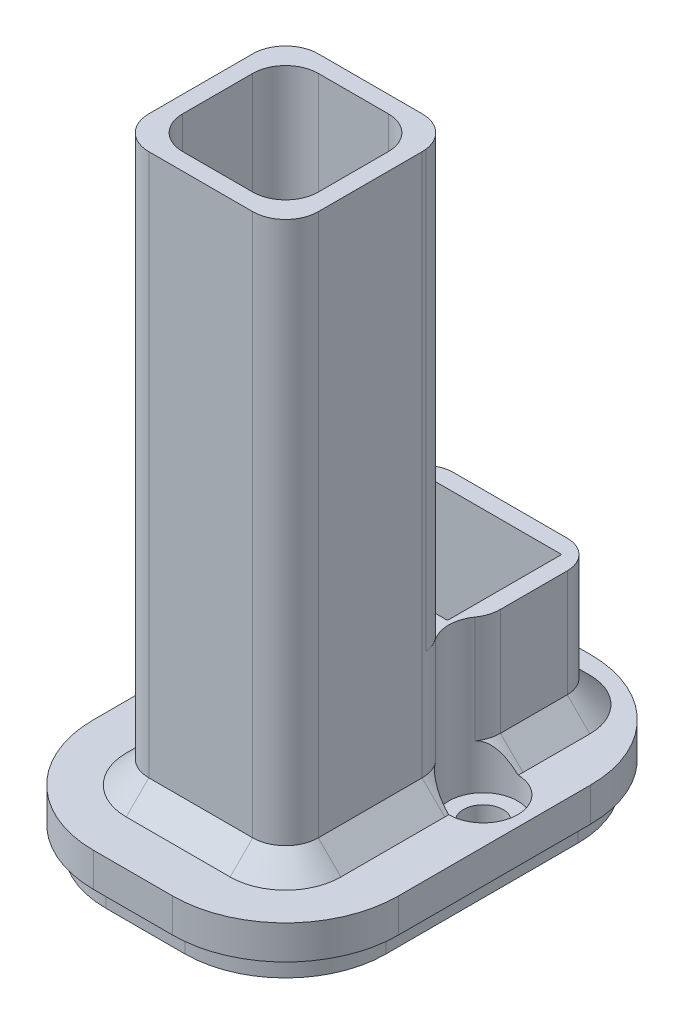
from build123d import *

# Parameters (mm, degrees)
SKETCH2_W               = 27
SKETCH2_H               = 37
SKETCH2_R               = 3
SKETCH2_W_2             = 15.1
SKETCH2_H_2             = 13.1
BOSS_EXTRUDE1_DEPTH     = 5
SKETCH2_7_W             = 15.1
SKETCH2_7_H             = 13.1
SKETCH2_7_W_2           = 12.1
SKETCH2_7_H_2           = 10.1
BOSS_EXTRUDE2_DEPTH     = 16.5
SKETCH2_8_W             = 12.1
SKETCH2_8_H             = 10.1
SKETCH2_8_R             = 4.25
BOSS_EXTRUDE3_DEPTH     = 1
SKETCH2_12_R            = 8.05
CUT_EXTRUDE3_DEPTH      = 4
SKETCH2_11_R            = 1.75
CUT_EXTRUDE2_DEPTH      = 32.729323976
FILLET1_R               = 10
CUT_EXTRUDE1_START      = -2
CUT_EXTRUDE1_DEPTH      = 2
SKETCH4_W               = 15
SKETCH4_H               = 15
SKETCH4_W_2             = 12
SKETCH4_H_2             = 12
BOSS_EXTRUDE8_DEPTH     = 50
FILLET4_R               = 2.5
CUT_EXTRUDE4_DEPTH      = 22
CUT_EXTRUDE4_DEPTH_BACK = 2
SKETCH4_3_R             = 1.75
FILLET3_START           = 16.5
FILLET3_DEPTH           = 38.5
FILLET3_START_2         = 5
FILLET3_2_DEPTH         = 11.898030769
FILLET5_R               = 3
CHAMFER1_SIZE           = 2
FILLET6_R               = 2.9


with BuildPart() as part:
    # Sketch2 → Boss-Extrude1 (new body)
    with BuildSketch(Plane(origin=(0, 0, 0), x_dir=(1, 0, 0), z_dir=(0, 1, 0))):
        with Locations((0, 5)):
            Rectangle(SKETCH2_W, SKETCH2_H)
        with Locations(Location((0, 0, 0), (0, 0, 270))):
            Circle(SKETCH2_R, mode=Mode.SUBTRACT)
        with Locations((0, 13.34)):
            Rectangle(SKETCH2_W_2, SKETCH2_H_2, mode=Mode.SUBTRACT)
    extrude(amount=BOSS_EXTRUDE1_DEPTH)

    # Sketch2<7> → Boss-Extrude2 (add)
    with BuildSketch(Plane(origin=(0, 0, 0), x_dir=(1, 0, 0), z_dir=(0, 1, 0))):
        with Locations((0, 13.34)):
            Rectangle(SKETCH2_7_W, SKETCH2_7_H)
        with Locations((0, 13.34)):
            Rectangle(SKETCH2_7_W_2, SKETCH2_7_H_2, mode=Mode.SUBTRACT)
    extrude(amount=BOSS_EXTRUDE2_DEPTH)

    # Sketch2<8> → Boss-Extrude3 (add)
    with BuildSketch(Plane(origin=(0, 0, 0), x_dir=(1, 0, 0), z_dir=(0, 1, 0))):
        with Locations((0, 13.34)):
            Rectangle(SKETCH2_8_W, SKETCH2_8_H)
        with Locations(Location((0, 13.34, 0), (0, 0, 270))):
            Circle(SKETCH2_8_R, mode=Mode.SUBTRACT)
    extrude(amount=BOSS_EXTRUDE3_DEPTH)

    # Sketch2<12> → Cut-Extrude3 (cut)
    with BuildSketch(Plane(origin=(0, 0, 0), x_dir=(1, 0, 0), z_dir=(0, 1, 0))):
        with Locations(Location((0, 0, 0), (0, 0, 270))):
            Circle(SKETCH2_12_R)
    extrude(amount=CUT_EXTRUDE3_DEPTH, mode=Mode.SUBTRACT)

    # Sketch2<11> → Cut-Extrude2 (cut, through all)
    with BuildSketch(Plane(origin=(0, 0, 0), x_dir=(1, 0, 0), z_dir=(0, 1, 0))):
        with Locations(Location((-9.5, 8, 0), (0, 0, 270))):
            Circle(SKETCH2_11_R)
        with Locations(Location((9.5, 8, 0), (0, 0, 270))):
            Circle(SKETCH2_11_R)
    extrude(amount=CUT_EXTRUDE2_DEPTH, mode=Mode.SUBTRACT)

    # Fillet1
    fillet1_edges = [part.edges().sort_by_distance(p)[0] for p in [
        (-13.5, 2.5, -23.5),
        (13.5, 2.5, -23.5),
        (13.5, 2.5, 13.5),
        (-13.5, 2.5, 13.5),
    ]]
    fillet(fillet1_edges, radius=FILLET1_R)

    # Sketch3 → Cut-Extrude1 (cut)
    with BuildSketch(Plane.XZ.offset(CUT_EXTRUDE1_START)):
        with BuildLine():
            Line((-13.5, 3.5), (-13.5, -13.5))
            ThreePointArc((-13.5, -13.5), (-10.571067812, -20.571067812), (-3.5, -23.5))
            Line((-3.5, -23.5), (3.5, -23.5))
            ThreePointArc((3.5, -23.5), (10.571067812, -20.571067812), (13.5, -13.5))
            Line((13.5, -13.5), (13.5, 3.5))
            ThreePointArc((13.5, 3.5), (10.571067812, 10.571067812), (3.5, 13.5))
            Line((3.5, 13.5), (-3.5, 13.5))
            ThreePointArc((-3.5, 13.5), (-10.571067812, 10.571067812), (-13.5, 3.5))
        make_face()
        with BuildLine():
            Line((-12.4, 3.5), (-12.4, -13.5))
            ThreePointArc((-12.4, -13.5), (-9.793250353, -19.793250353), (-3.5, -22.4))
            Line((-3.5, -22.4), (3.5, -22.4))
            ThreePointArc((3.5, -22.4), (9.793250353, -19.793250353), (12.4, -13.5))
            Line((12.4, -13.5), (12.4, 3.5))
            ThreePointArc((12.4, 3.5), (9.793250353, 9.793250353), (3.5, 12.4))
            Line((3.5, 12.4), (-3.5, 12.4))
            ThreePointArc((-3.5, 12.4), (-9.793250353, 9.793250353), (-12.4, 3.5))
        make_face(mode=Mode.SUBTRACT)
    extrude(amount=CUT_EXTRUDE1_DEPTH, mode=Mode.SUBTRACT)

    # Sketch4 → Boss-Extrude8 (add)
    with BuildSketch(Plane(origin=(0, 5, 0), x_dir=(1, 0, 0), z_dir=(0, 1, 0))):
        Rectangle(SKETCH4_W, SKETCH4_H)
        Rectangle(SKETCH4_W_2, SKETCH4_H_2, mode=Mode.SUBTRACT)
    extrude(amount=BOSS_EXTRUDE8_DEPTH)

    # Fillet4
    # the kernel refuses this fillet: 2.5 mm, written as the material it takes off along each edge
    with BuildSketch(Plane(origin=(-7.55, 5, -19.89), x_dir=(0, 0, 1), z_dir=(0, 1, 0))) as fillet4_piece_1:
        with BuildLine():
            CenterArc((FILLET4_R, FILLET4_R), FILLET4_R, 180, 90)
            Line((0, FILLET4_R), (0, 0))
            Line((0, 0), (FILLET4_R, 0))
        make_face()
    extrude(amount=17.75, mode=Mode.SUBTRACT)
    with BuildSketch(Plane(origin=(7.55, 5, -19.89), x_dir=(0, 0, 1), z_dir=(0, 1, 0))) as fillet4_piece_2:
        with BuildLine():
            CenterArc((FILLET4_R, -FILLET4_R), FILLET4_R, 90, 90)
            Line((0, -FILLET4_R), (0, 0))
            Line((0, 0), (FILLET4_R, 0))
        make_face()
    extrude(amount=17.75, mode=Mode.SUBTRACT)
    with BuildSketch(Plane(origin=(7.55, 5, -6.79), x_dir=(-1, 0, 0), z_dir=(0, 1, 0))) as fillet4_piece_3:
        with BuildLine():
            CenterArc((2.5, -0.497493719), FILLET4_R, 168.521659045, 11.478340955)
            Line((0, -0.497493719), (0, 0))
            Line((0, 0), (0.05, 0))
        make_face()
    extrude(amount=12.743734296, mode=Mode.SUBTRACT)
    with BuildSketch(Plane(origin=(-7.55, 5, -6.79), x_dir=(0, 0, -1), z_dir=(0, 1, 0))) as fillet4_piece_4:
        with BuildLine():
            CenterArc((0.497493719, -2.5), FILLET4_R, 90, 11.478340955)
            Line((0, -0.05), (0, 0))
            Line((0, 0), (0.497493719, 0))
        make_face()
    extrude(amount=12.743734296, mode=Mode.SUBTRACT)

    # Sketch4<3> → Cut-Extrude4 (cut, two sides: drawn at the far end of the back side and taken through both)
    # profile 1 of 8: a face of its own
    with BuildSketch(Plane(origin=(0, 5, 0), x_dir=(1, 0, 0), z_dir=(0, 1, 0)).offset(-CUT_EXTRUDE4_DEPTH_BACK)):
        with BuildLine():
            Line((7.5, 6.79), (7.5, 5.697284212))
            ThreePointArc((7.5, 5.697284212), (10.765405073, 5.22488739), (12.55, 8))
            ThreePointArc((12.55, 8), (10.795183385, 10.761340254), (7.55, 10.34520788))
            Line((7.55, 10.34520788), (7.55, 6.79))
            Line((7.55, 6.79), (7.5, 6.79))
        make_face()
        with Locations(Location((9.5, 8, 0), (0, 0, 270))):
            Circle(SKETCH4_3_R, mode=Mode.SUBTRACT)
    # profile 2 of 8: a face of its own
    with BuildSketch(Plane(origin=(0, 5, 0), x_dir=(1, 0, 0), z_dir=(0, 1, 0)).offset(-CUT_EXTRUDE4_DEPTH_BACK)):
        with BuildLine():
            Line((7.5, 7.5), (7.5, 6.79))
            Line((7.5, 6.79), (7.55, 6.79))
            Line((7.55, 6.79), (7.55, 10.34520788))
            ThreePointArc((7.55, 10.34520788), (6.641491505, 9.063686601), (6.491262723, 7.5))
            Line((6.491262723, 7.5), (7.5, 7.5))
        make_face()
    # profile 3 of 8: a face of its own
    with BuildSketch(Plane(origin=(0, 5, 0), x_dir=(1, 0, 0), z_dir=(0, 1, 0)).offset(-CUT_EXTRUDE4_DEPTH_BACK)):
        with BuildLine():
            Line((6.700285729, 6.79), (7.5, 6.79))
            Line((7.5, 6.79), (7.5, 7.5))
            Line((7.5, 7.5), (6.491262723, 7.5))
            ThreePointArc((6.491262723, 7.5), (6.57415784, 7.138636166), (6.700285729, 6.79))
        make_face()
    # profile 4 of 8: a face of its own
    with BuildSketch(Plane(origin=(0, 5, 0), x_dir=(1, 0, 0), z_dir=(0, 1, 0)).offset(-CUT_EXTRUDE4_DEPTH_BACK)):
        with BuildLine():
            ThreePointArc((6.700285729, 6.79), (7.038735849, 6.198700808), (7.5, 5.697284212))
            Line((7.5, 5.697284212), (7.5, 6.79))
            Line((7.5, 6.79), (6.700285729, 6.79))
        make_face()
    # profile 5 of 8: a face of its own
    with BuildSketch(Plane(origin=(0, 5, 0), x_dir=(1, 0, 0), z_dir=(0, 1, 0)).offset(-CUT_EXTRUDE4_DEPTH_BACK)):
        with BuildLine():
            Line((-7.55, 6.79), (-7.5, 6.79))
            Line((-7.5, 6.79), (-7.5, 7.5))
            Line((-7.5, 7.5), (-6.491262723, 7.5))
            ThreePointArc((-6.491262723, 7.5), (-6.460333185, 7.749150138), (-6.45, 8))
            ThreePointArc((-6.45, 8), (-6.738659746, 9.295183385), (-7.55, 10.34520788))
            Line((-7.55, 10.34520788), (-7.55, 6.79))
        make_face()
    # profile 6 of 8: a face of its own
    with BuildSketch(Plane(origin=(0, 5, 0), x_dir=(1, 0, 0), z_dir=(0, 1, 0)).offset(-CUT_EXTRUDE4_DEPTH_BACK)):
        with BuildLine():
            Line((-7.5, 6.79), (-6.700285729, 6.79))
            ThreePointArc((-6.700285729, 6.79), (-6.57415784, 7.138636166), (-6.491262723, 7.5))
            Line((-6.491262723, 7.5), (-7.5, 7.5))
            Line((-7.5, 7.5), (-7.5, 6.79))
        make_face()
    # profile 7 of 8: a face of its own
    with BuildSketch(Plane(origin=(0, 5, 0), x_dir=(1, 0, 0), z_dir=(0, 1, 0)).offset(-CUT_EXTRUDE4_DEPTH_BACK)):
        with BuildLine():
            ThreePointArc((-7.55, 10.34520788), (-12.549823537, 7.967191549), (-7.5, 5.697284212))
            Line((-7.5, 5.697284212), (-7.5, 6.79))
            Line((-7.5, 6.79), (-7.55, 6.79))
            Line((-7.55, 6.79), (-7.55, 10.34520788))
        make_face()
        with Locations(Location((-9.5, 8, 0), (0, 0, 270))):
            Circle(SKETCH4_3_R, mode=Mode.SUBTRACT)
    # profile 8 of 8: a face of its own
    with BuildSketch(Plane(origin=(0, 5, 0), x_dir=(1, 0, 0), z_dir=(0, 1, 0)).offset(-CUT_EXTRUDE4_DEPTH_BACK)):
        with BuildLine():
            Line((-7.5, 6.79), (-7.5, 5.697284212))
            ThreePointArc((-7.5, 5.697284212), (-7.038735849, 6.198700808), (-6.700285729, 6.79))
            Line((-6.700285729, 6.79), (-7.5, 6.79))
        make_face()
    extrude(amount=CUT_EXTRUDE4_DEPTH + CUT_EXTRUDE4_DEPTH_BACK, mode=Mode.SUBTRACT)

    # Fillet3: read off the stored shape, not the designer's step
    # Fillet3 outline → Fillet3 (cut)
    with BuildSketch(Plane(origin=(0, 0, 0), x_dir=(1, 0, 0), z_dir=(0, 1, 0)).offset(FILLET3_START)):
        with BuildLine():
            Line((7.5, -7.5), (7.5, -4.6))
            ThreePointArc((7.5, -4.6), (6.650609665, -6.650609665), (4.6, -7.5))
            Line((4.6, -7.5), (7.5, -7.5))
        make_face()
        with BuildLine():
            ThreePointArc((4.6, 7.5), (6.650609665, 6.650609665), (7.5, 4.6))
            Line((7.5, 4.6), (7.5, 7.5))
            Line((7.5, 7.5), (4.6, 7.5))
        make_face()
        with BuildLine():
            Line((-7.5, -7.5), (-4.6, -7.5))
            ThreePointArc((-4.6, -7.5), (-6.650609665, -6.650609665), (-7.5, -4.6))
            Line((-7.5, -4.6), (-7.5, -7.5))
        make_face()
        with BuildLine():
            ThreePointArc((-7.5, 4.6), (-6.650609665, 6.650609665), (-4.6, 7.5))
            Line((-4.6, 7.5), (-7.5, 7.5))
            Line((-7.5, 7.5), (-7.5, 4.6))
        make_face()
    extrude(amount=FILLET3_DEPTH, mode=Mode.SUBTRACT)

    # Fillet3 2 outline → Fillet3 2 (cut)
    with BuildSketch(Plane(origin=(0, 0, 0), x_dir=(1, 0, 0), z_dir=(0, 1, 0)).offset(FILLET3_START_2)):
        with BuildLine():
            Line((7.5, -7.5), (7.5, -4.6))
            ThreePointArc((7.5, -4.6), (6.650609665, -6.650609665), (4.6, -7.5))
            Line((4.6, -7.5), (7.5, -7.5))
        make_face()
        with BuildLine():
            Line((-7.5, -7.5), (-4.6, -7.5))
            ThreePointArc((-4.6, -7.5), (-6.650609665, -6.650609665), (-7.5, -4.6))
            Line((-7.5, -4.6), (-7.5, -7.5))
        make_face()
    extrude(amount=FILLET3_2_DEPTH, mode=Mode.SUBTRACT)

    # Fillet5
    # the kernel refuses this fillet: 3 mm, written as the material it takes off along each edge
    with BuildSketch(Plane(origin=(-7.55, 19.333243866, -10.34520788), x_dir=(0.6778637103057632, 0, 0.7351875884769167), z_dir=(0, -1, 0))) as fillet5_piece_1:
        with BuildLine():
            CenterArc((1.200404841, -2.973784045), FILLET5_R, 97.58012931, 35.096801228)
            Line((-0.83318629, -0.76822128), (0, 0))
            ThreePointArc((0, 0), (0.402333491, -0.026652888), (0.804666981, 0))
        make_face()
    extrude(amount=14.333243866, mode=Mode.SUBTRACT)
    with BuildSketch(Plane(origin=(-7.5, 5, -5.697284212), x_dir=(0.6645067572488152, 0, -0.7472822556241144), z_dir=(0, 1, 0))) as fillet5_piece_2:
        with BuildLine():
            CenterArc((1.168873021, -2.975148897), FILLET5_R, 97.379893382, 34.264602894)
            Line((-0.82464725, -0.733302131), (0, 0))
            ThreePointArc((0, 0), (0.391765134, -0.025265288), (0.783530267, 0))
        make_face()
    extrude(amount=14.258821195, mode=Mode.SUBTRACT)
    with BuildSketch(Plane(origin=(7.55, 19.333243866, -10.34520788), x_dir=(0, 0, -1), z_dir=(0, -1, 0))) as fillet5_piece_3:
        with BuildLine():
            CenterArc((1.133297546, -3), FILLET5_R, 90, 35.096801228)
            ThreePointArc((-0.591581177, -0.545454545), (-0.277723563, -0.292322145), (0, 0))
            Line((0, 0), (1.133297546, 0))
        make_face()
    extrude(amount=14.333243866, mode=Mode.SUBTRACT)
    with BuildSketch(Plane(origin=(7.5, 19.258821195, -5.697284212), x_dir=(0, 0, 1), z_dir=(0, -1, 0))) as fillet5_piece_4:
        with BuildLine():
            CenterArc((1.103528478, 3), FILLET5_R, 235.735397106, 34.264602894)
            ThreePointArc((-0.585518265, 0.520661157), (-0.275970178, 0.27921088), (0, 0))
            Line((0, 0), (1.103528478, 0))
        make_face()
    extrude(amount=14.258821195, mode=Mode.SUBTRACT)

    # Chamfer1
    # the kernel refuses this chamfer: 2 mm, written as the material it adds along each edge
    with BuildSketch(Plane(origin=(-5.05, 5, -19.89), x_dir=(0, 0, -1), z_dir=(1, 0, 0))) as chamfer1_piece_1:
        Polygon((CHAMFER1_SIZE, 0), (0, CHAMFER1_SIZE), (0, 0), align=None)
    extrude(amount=10.1)
    with BuildSketch(Plane(origin=(-5.05, 5, -17.39), x_dir=(0, 0, -1), z_dir=(1, 0, 0))) as chamfer1_piece_2:
        Polygon((2.5 + CHAMFER1_SIZE, 0), (2.5, CHAMFER1_SIZE), (2.5, 0), align=None)
    revolve(axis=Axis((-5.05, 5, -17.39), (0, 1, 0)), revolution_arc=90)
    with BuildSketch(Plane(origin=(5.05, 5, -17.39), x_dir=(1, 0, 0), z_dir=(0, 0, 1))) as chamfer1_piece_3:
        Polygon((2.5 + CHAMFER1_SIZE, 0), (2.5, CHAMFER1_SIZE), (2.5, 0), align=None)
    revolve(axis=Axis((5.05, 5, -17.39), (0, 1, 0)), revolution_arc=90)
    with BuildSketch(Plane(origin=(7.5, 5, 4.6), x_dir=(1, 0, 0), z_dir=(0, 0, -1)), Plane(origin=(-7.5, 5, -4.593755734), x_dir=(-1, 0, 0), z_dir=(0, 0, 1))) as chamfer1_piece_4:
        Polygon((CHAMFER1_SIZE, 0), (0, -CHAMFER1_SIZE), (0, 0), align=None)
    extrude(amount=9.193755734)
    with BuildSketch(Plane(origin=(-4.6, 5, 7.5), x_dir=(0, 0, 1), z_dir=(1, 0, 0))) as chamfer1_piece_5:
        Polygon((CHAMFER1_SIZE, 0), (0, -CHAMFER1_SIZE), (0, 0), align=None)
    extrude(amount=9.2)
    with BuildSketch(Plane(origin=(4.599999998, 5, 4.599999998), x_dir=(1.0, 0, 5.191813260135323e-10), z_dir=(5.191813260135323e-10, 0, -1.0))) as chamfer1_piece_6:
        Polygon((2.900000002 + CHAMFER1_SIZE, 0), (2.900000002, -CHAMFER1_SIZE), (2.900000002, 0), align=None)
    revolve(axis=Axis((4.599999998, 5, 4.599999998), (0, -1, 0)), revolution_arc=89.999999941)
    with BuildSketch(Plane(origin=(-4.599999998, 5, 4.599999998), x_dir=(-5.191813260135323e-10, 0, 1.0), z_dir=(1.0, 0, 5.191813260135323e-10))) as chamfer1_piece_7:
        Polygon((2.900000002 + CHAMFER1_SIZE, 0), (2.900000002, -CHAMFER1_SIZE), (2.900000002, 0), align=None)
    revolve(axis=Axis((-4.599999998, 5, 4.599999998), (0, -1, 0)), revolution_arc=89.999999941)
    with BuildSketch(Plane(origin=(-7.55, 5, -11.478505426), x_dir=(-1, 0, 0), z_dir=(0, 0, -1)), Plane(origin=(7.55, 5, -17.39), x_dir=(1, 0, 0), z_dir=(0, 0, 1))) as chamfer1_piece_8:
        Polygon((CHAMFER1_SIZE, 0), (0, CHAMFER1_SIZE), (0, 0), align=None)
    extrude(amount=5.911494574)
    with BuildSketch(Plane(origin=(-4.55, 5, -11.478505426), x_dir=(0.6862482592405377, 0, 0.7273673945739744), z_dir=(0.7273673945739744, 0, -0.6862482592405377))) as chamfer1_piece_9_section:
        Polygon((3 + CHAMFER1_SIZE, 0), (3, -CHAMFER1_SIZE), (3, 0), align=None)
    chamfer1_piece_9 = revolve(axis=Axis((-4.55, 5, -11.478505426), (0, -1, 0)), revolution_arc=133.333854906, mode=Mode.PRIVATE)
    chamfer1_piece_9 = chamfer1_piece_9 - Plane(origin=(-9.5, 5, -8), x_dir=(0.9864712382511708, 0, 0.16393442622952004), z_dir=(0, 1, 0)) * Cylinder(3.05, 20, mode=Mode.PRIVATE)
    chamfer1_piece_9 = split(chamfer1_piece_9, bisect_by=Plane(origin=(-6.05, 5, -11.478505426), z_dir=(-1, 0, 0)), keep=Keep.TOP, mode=Mode.PRIVATE)
    add(chamfer1_piece_9)
    with BuildSketch(Plane(origin=(-4.5, 5, -4.593755734), x_dir=(0.6756079062799596, 0, -0.7372611185814761), z_dir=(0.7372611185814761, 0, 0.6756079062799596))) as chamfer1_piece_10_section:
        Polygon((3 + CHAMFER1_SIZE, 0), (3, CHAMFER1_SIZE), (3, 0), align=None)
    chamfer1_piece_10 = revolve(axis=Axis((-4.5, 5, -4.593755734), (0, 1, 0)), revolution_arc=132.501375425, mode=Mode.PRIVATE)
    chamfer1_piece_10 = chamfer1_piece_10 - Plane(origin=(-9.5, 5, -8), x_dir=(0.9864712382511708, 0, 0.16393442622952004), z_dir=(0, 1, 0)) * Cylinder(3.05, 21, mode=Mode.PRIVATE)
    chamfer1_piece_10 = split(chamfer1_piece_10, bisect_by=Plane(origin=(-4.5, 5, -8.29), z_dir=(0, 0, 1)), keep=Keep.TOP, mode=Mode.PRIVATE)
    add(chamfer1_piece_10)
    with BuildSketch(Plane(origin=(4.55, 5, -11.478505426), x_dir=(1, 0, 0), z_dir=(0, 0, -1))) as chamfer1_piece_11_section:
        Polygon((3 + CHAMFER1_SIZE, 0), (3, -CHAMFER1_SIZE), (3, 0), align=None)
    chamfer1_piece_11 = revolve(axis=Axis((4.55, 5, -11.478505426), (0, -1, 0)), revolution_arc=133.333854906, mode=Mode.PRIVATE)
    chamfer1_piece_11 = chamfer1_piece_11 - Plane(origin=(9.5, 5, -8), x_dir=(-0.6557377049180538, 0, 0.7549887829291264), z_dir=(0, 1, 0)) * Cylinder(3.05, 21, mode=Mode.PRIVATE)
    chamfer1_piece_11 = split(chamfer1_piece_11, bisect_by=Plane(origin=(6.05, 5, -11.478505426), z_dir=(1, 0, 0)), keep=Keep.TOP, mode=Mode.PRIVATE)
    add(chamfer1_piece_11)
    with BuildSketch(Plane(origin=(4.5, 5, -4.593755734), x_dir=(-0.6756079062798056, 0, -0.7372611185816172), z_dir=(-0.7372611185816172, 0, 0.6756079062798056))) as chamfer1_piece_12_section:
        Polygon((3 + CHAMFER1_SIZE, 0), (3, -CHAMFER1_SIZE), (3, 0), align=None)
    chamfer1_piece_12 = revolve(axis=Axis((4.5, 5, -4.593755734), (0, -1, 0)), revolution_arc=132.501375425, mode=Mode.PRIVATE)
    chamfer1_piece_12 = chamfer1_piece_12 - Plane(origin=(9.5, 5, -8), x_dir=(-0.6557377049180538, 0, 0.7549887829291264), z_dir=(0, 1, 0)) * Cylinder(3.05, 21, mode=Mode.PRIVATE)
    chamfer1_piece_12 = split(chamfer1_piece_12, bisect_by=Plane(origin=(4.5, 5, -8.29), z_dir=(0, 0, 1)), keep=Keep.TOP, mode=Mode.PRIVATE)
    add(chamfer1_piece_12)

    # Fillet6
    fillet6_edges = [part.edges().sort_by_distance(p)[0] for p in [
        (6, 30, -6),
        (6, 30, 6),
        (-6, 30, 6),
        (-6, 30, -6),
    ]]
    fillet(fillet6_edges, radius=FILLET6_R)


solid = part.part
